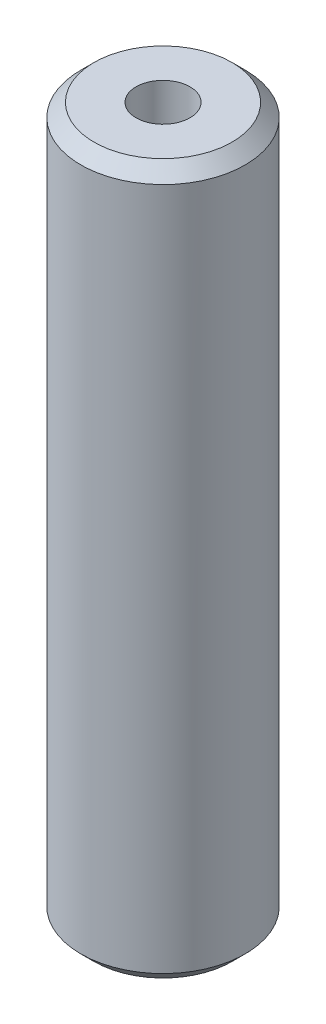
from build123d import *

# Parameters (mm, degrees)
SKETCH1_R           = 10
BOSS_EXTRUDE1_DEPTH = 86.335247887
SKETCH2_R           = 3.275554459
CUT_EXTRUDE1_DEPTH  = 88.485856158
CHAMFER1_SIZE       = 1.601163961


with BuildPart() as part:
    # Sketch1 → Boss-Extrude1 (new body)
    with BuildSketch(Plane(origin=(0, 0, 0), x_dir=(1, 0, 0), z_dir=(0, 1, 0))):
        Circle(SKETCH1_R)
    extrude(amount=BOSS_EXTRUDE1_DEPTH)

    # Sketch2 → Cut-Extrude1 (cut, through all)
    with BuildSketch(Plane(origin=(0, 0, 0), x_dir=(1, 0, 0), z_dir=(0, 1, 0))):
        Circle(SKETCH2_R)
    extrude(amount=CUT_EXTRUDE1_DEPTH, mode=Mode.SUBTRACT)

    # Chamfer1
    chamfer1_edges = [part.edges().sort_by_distance(p)[0] for p in [
        (-10, 86.335247887, 0),
        (-10, 0, 0),
    ]]
    chamfer(chamfer1_edges, length=CHAMFER1_SIZE)


solid = part.part
